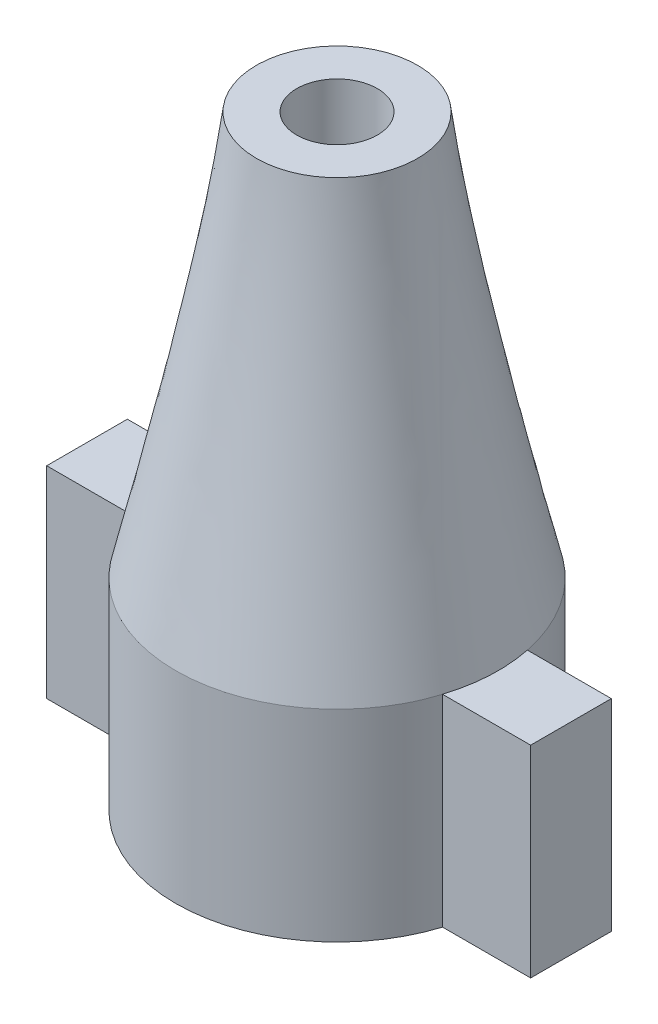
from build123d import *

# Parameters (mm, degrees)
SKETCH_1_R          = 2
EXTRUDE_2_DEPTH     = 10
SKETCH_4_R          = 1
CUT_EXTRUDE_1_DEPTH = 1.5
SKETCH_5_R          = 2.55
CUT_EXTRUDE_2_DEPTH = 1.5
OTHER_4_OUTLINE_R   = 2.55
OTHER_4_DEPTH       = 1.5
SKETCH_9_R          = 4
SKETCH_9_R_2        = 2.55
EXTRUDE_3_DEPTH     = 5
SKETCH_11_W         = 3.45
SKETCH_11_H         = 2
EXTRUDE_4_DEPTH     = 5
SKETCH_13_R         = 2.55
SKETCH_13_R_2       = 1.36
EXTRUDE_6_DEPTH     = 5
SKETCH_14_R         = 2.75
CUT_EXTRUDE_3_DEPTH = 5
SKETCH_17_R         = 1
CUT_EXTRUDE_4_DEPTH = 8
SKETCH_18_R         = 1.5
CUT_EXTRUDE_5_DEPTH = 8
SKETCH_19_R         = 2.75
SKETCH_19_R_2       = 2.55
EXTRUDE_7_DEPTH     = 5
SKETCH_20_R         = 4.616191904
CUT_EXTRUDE_6_DEPTH = 10


with BuildPart() as part:
    # 草图1 → 凸台-拉伸2 (new body)
    with BuildSketch(Plane(origin=(0, 0, 0), x_dir=(1, 0, 0), z_dir=(0, 1, 0))):
        with Locations(Location((0, 0, 0), (0, 0, 270))):
            Circle(SKETCH_1_R)
    extrude(amount=EXTRUDE_2_DEPTH)

    # 放样1: read off the stored shape, not the designer's step
    # 放样1: loft between two sections, ruled curve by curve
    loft_1_from = [
        Edge.make_bspline([(3.527981201, 0, 1.885032797), (7.298046794, 0, -5.170929606), (0.242084392, 0, -8.940995199), (-3.527981201, 0, -1.885032797), (-7.298046794, 0, 5.170929606), (-0.242084392, 0, 8.940995199), (3.527981201, 0, 1.885032797)], [0, 0, 0, 0, 0.5, 0.5, 0.5, 1, 1, 1, 1], 3, [1, 0.333333333, 0.333333333, 1, 0.333333333, 0.333333333, 1]),
    ]
    loft_1_to = [
        Edge.make_bspline([(1.985312696, 10, -0.241936974), (1.501438748, 10, -4.212562366), (-2.469186644, 10, -3.728688418), (-1.985312696, 10, 0.241936974), (-1.501438748, 10, 4.212562366), (2.469186644, 10, 3.728688418), (1.985312696, 10, -0.241936974)], [0, 0, 0, 0, 0.5, 0.5, 0.5, 1, 1, 1, 1], 3, [1, 0.333333333, 0.333333333, 1, 0.333333333, 0.333333333, 1]),
    ]
    loft_1 = Solid(Shell([*[Face.make_surface_from_curves(loft_1_from[k], loft_1_to[k]) for k in range(1)], Face(Wire(loft_1_from)), Face(Wire(loft_1_to))]))
    add(loft_1)

    # 草图4 → 切除-拉伸1 (cut)
    with BuildSketch(Plane.XZ):
        with Locations(Location((0, 0, 0), (0, 0, 270))):
            Circle(SKETCH_4_R)
    extrude(amount=-CUT_EXTRUDE_1_DEPTH, mode=Mode.SUBTRACT)

    # 草图5 → 切除-拉伸2 (cut)
    with BuildSketch(Plane.XZ):
        with Locations(Location((0, 0, 0), (0, 0, 270))):
            Circle(SKETCH_5_R)
    extrude(amount=-CUT_EXTRUDE_2_DEPTH, mode=Mode.SUBTRACT)

    # 边界4: read off the stored shape, not the designer's step
    # 边界4 outline → 边界4 (add)
    with BuildSketch(Plane(origin=(0, 0, 0), x_dir=(1, 0, 0), z_dir=(0, 1, 0))):
        Circle(OTHER_4_OUTLINE_R)
    extrude(amount=OTHER_4_DEPTH)

    # 切除-扫描1: sweep along a path in 草图7
    with BuildLine(Plane.XZ) as sweep_1_path:
        CenterArc((0, 0), 2.55, 0, 360)
    # 草图8 → 切除-扫描1 (sweep, cut)
    with BuildSketch(Plane.XY):
        with BuildLine():
            Line((0, 1.5), (0, 0))
            Line((0, 0), (2.55, 0))
            add(Edge.make_bspline(
                [(2.55, 0), (2.066182345, 1.609227038), (0, 1.5)],
                knots=[0, 0, 0, 1, 1, 1], degree=2))
        make_face()
    sweep(path=sweep_1_path.line, mode=Mode.SUBTRACT)

    # 草图9 → 凸台-拉伸3 (add)
    with BuildSketch(Plane.XZ):
        with Locations(Location((0, 0, 0), (0, 0, 28.116))):
            Circle(SKETCH_9_R)
        with Locations(Location((0, 0, 0), (0, 0, 90))):
            Circle(SKETCH_9_R_2, mode=Mode.SUBTRACT)
    extrude(amount=EXTRUDE_3_DEPTH)

    # 草图11 → 凸台-拉伸4 (add)
    with BuildSketch(Plane.XZ.offset(5)):
        with Locations((4.275, 0.199370755)):
            Rectangle(SKETCH_11_W, SKETCH_11_H)
        with Locations((-4.275, 0.199370755)):
            Rectangle(SKETCH_11_W, SKETCH_11_H)
    extrude(amount=-EXTRUDE_4_DEPTH)

    # 草图14 → 切除-拉伸3 (cut)
    with BuildSketch(Plane.XZ.offset(5)):
        with Locations(Location((0, 0, 0), (0, 0, 270))):
            Circle(SKETCH_14_R)
    extrude(amount=-CUT_EXTRUDE_3_DEPTH, mode=Mode.SUBTRACT)

    # 切除-扫描2: sweep along a path in 草图16
    with BuildLine(Plane.XZ) as sweep_2_path:
        CenterArc((0, 0), 2.75, 0, 360)
    # 草图15 → 切除-扫描2 (sweep, cut)
    with BuildSketch(Plane.XY):
        with BuildLine():
            Line((0, 0), (2.75, 0))
            add(Edge.make_bspline(
                [(2.75, 0), (2.619849206, 1.771452228), (0, 1.6)],
                knots=[0, 0, 0, 1, 1, 1], degree=2))
            Line((0, 1.6), (0, 0))
        make_face()
    sweep(path=sweep_2_path.line, mode=Mode.SUBTRACT)

    # 草图17 → 切除-拉伸4 (cut)
    with BuildSketch(Plane(origin=(0, 10, 0), x_dir=(1, 0, 0), z_dir=(0, 1, 0))):
        with Locations(Location((0, 0, 0), (0, 0, 270))):
            Circle(SKETCH_17_R)
    extrude(amount=-CUT_EXTRUDE_4_DEPTH, mode=Mode.SUBTRACT)


with BuildPart() as body_2:
    # 草图13 → 凸台-拉伸6 (new body)
    with BuildSketch(Plane.XZ.offset(5)):
        with Locations(Location((13.780391227, 0, 0), (0, 0, 270))):
            Circle(SKETCH_13_R)
        with Locations(Location((13.780391227, 0, 0), (0, 0, 270))):
            Circle(SKETCH_13_R_2, mode=Mode.SUBTRACT)
    extrude(amount=-EXTRUDE_6_DEPTH)

    # 草图18 → 切除-拉伸5 (cut)
    with BuildSketch(Plane.XZ.offset(5)):
        with Locations(Location((13.780391227, 0, 0), (0, 0, 270))):
            Circle(SKETCH_18_R)
    extrude(amount=-CUT_EXTRUDE_5_DEPTH, mode=Mode.SUBTRACT)

    # 草图19 → 凸台-拉伸7 (add)
    with BuildSketch(Plane.XZ.offset(5)):
        with Locations(Location((13.780391227, 0, 0), (0, 0, 270))):
            Circle(SKETCH_19_R)
        with Locations((13.780391227, 0)):
            Circle(SKETCH_19_R_2, mode=Mode.SUBTRACT)
    extrude(amount=-EXTRUDE_7_DEPTH)

    # 草图20 → 切除-拉伸6 (cut)
    with BuildSketch(Plane(origin=(0, 0, 0), x_dir=(1, 0, 0), z_dir=(0, 1, 0))):
        with Locations((13.780391227, 0)):
            Circle(SKETCH_20_R)
    extrude(amount=-CUT_EXTRUDE_6_DEPTH, mode=Mode.SUBTRACT)


solid = part.part
